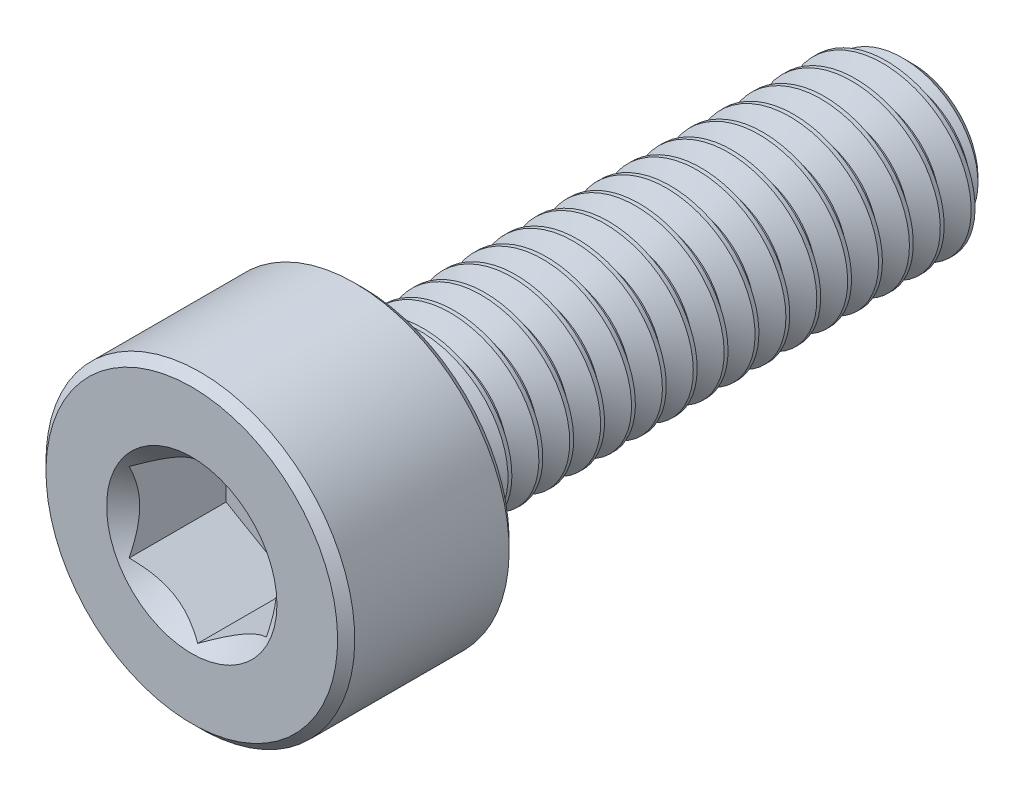
from build123d import *

# Parameters (mm, degrees)
CUT_EXTRUDE1_DEPTH     = 1.5
SPLIT1_SURFACE_1_BACK  = 13.278
SPLIT1_SURFACE_1_DEPTH = 26.556
SPLIT1_SURFACE_2_BACK  = 13.278
SPLIT1_SURFACE_2_DEPTH = 26.556
CUT_SWEEP1_PITCH       = 0.45


with BuildPart() as part:
    # Sketch2 → Revolve1 (revolve)
    with BuildSketch(Plane(origin=(0, 0, 0), x_dir=(0, 0, -1), z_dir=(1, 0, 0))):
        with BuildLine():
            Line((-5.25, 0), (-5.25, 2.125))
            Line((-5.25, 2.125), (-5.125, 2.25))
            Line((-5.125, 2.25), (-2.875, 2.25))
            Line((-2.875, 2.25), (-2.75, 2.125))
            Line((-2.75, 2.125), (-2.75, 1.375))
            ThreePointArc((-2.75, 1.375), (-2.713388348, 1.286611652), (-2.625, 1.25))
            Line((-2.625, 1.25), (4.957716426, 1.25))
            Line((4.957716426, 1.25), (5.25, 0.957716426))
            Line((5.25, 0.957716426), (5.25, 0))
            Line((5.25, 0), (-5.25, 0))
        make_face()
    revolve(axis=Axis((0, 0, -5.25), (0, 0, 1)))

    # Sketch3 → Cut-Extrude1 (cut)
    with BuildSketch(Plane.XY.offset(5.25)):
        Polygon((1, -0.577350269), (1, 0.577350269), (0, 1.154700538), (-1, 0.577350269), (-1, -0.577350269), (0, -1.154700538), align=None)
    extrude(amount=-CUT_EXTRUDE1_DEPTH, mode=Mode.SUBTRACT)

    # Cut-Extrude2 cone 1 section (through the dimple's axis) → Cut-Extrude2 (revolve, cut)
    with BuildSketch(Plane(origin=(0, 0, 5.25), x_dir=(0, -1, 0), z_dir=(1, 0, 0))):
        Polygon((0, 0), (1.241303079, 0), (0, 1.241303079), align=None)
    revolve(axis=Axis((0, 0, 5.25), (0, 0, -1)), mode=Mode.SUBTRACT)


with BuildPart() as body_2:
    # Split1: the piece behind the surface
    add(part.part)
    # Split1 surface: a surface, the sketch's curves swept straight by 26.556 mm
    with BuildLine(Plane(origin=(0, 0, 0), x_dir=(0, 0, -1), z_dir=(1, 0, 0)).offset(-SPLIT1_SURFACE_1_BACK), mode=Mode.PRIVATE) as split1_surface_1_path:
        Line((-2.625, -2.25), (-2.625, 2.25))
    split1_surface_1 = Shell.extrude(split1_surface_1_path.wire(), (1 * SPLIT1_SURFACE_1_DEPTH, 0 * SPLIT1_SURFACE_1_DEPTH, 0 * SPLIT1_SURFACE_1_DEPTH))
    split(bisect_by=split1_surface_1, keep=Keep.BOTTOM)

    # Cut-Sweep1: the profile of Sketch7 screwed along a right-hand helix of 18.777778 turns, 6 arcs to a turn; built about Z, then put on its axis
    cut_sweep1_z = Axis((0, 0, 0), (0, 0, 1))
    cut_sweep1_corners = [(1.274356964, 0, 0.0140625), (1.274356964, 0, -0.4078125), (0.957716426, 0, -0.225), (0.957716426, 0, -0.16875)]
    with BuildLine(mode=Mode.PRIVATE) as cut_sweep1_profile:
        Line(cut_sweep1_corners[0], cut_sweep1_corners[1])
        Line(cut_sweep1_corners[1], cut_sweep1_corners[2])
        Line(cut_sweep1_corners[2], cut_sweep1_corners[3])
        Line(cut_sweep1_corners[3], cut_sweep1_corners[0])
    cut_sweep1_cap = Face(cut_sweep1_profile.wire())
    cut_sweep1_turn_angles = [0, 30, 60, 90, 120, 150, 180, 210, 240, 270, 300, 330, 360]
    cut_sweep1_turn_weights = [1, 0.8660254037844387, 1, 0.8660254037844387, 1, 0.8660254037844387, 1, 0.8660254037844387, 1, 0.8660254037844387, 1, 0.8660254037844387, 1]
    cut_sweep1_turn_rails = [Edge.make_bspline([Vector(p[0], p[1], 0).rotate(cut_sweep1_z, cut_sweep1_turn_angles[k]) / cut_sweep1_turn_weights[k] + Vector(0, 0, p[2] + CUT_SWEEP1_PITCH * cut_sweep1_turn_angles[k] / 360) for k in range(13)], [0, 0, 0, 1, 1, 2, 2, 3, 3, 4, 4, 5, 5, 6, 6, 6], 2, cut_sweep1_turn_weights) for p in cut_sweep1_corners]
    cut_sweep1_turn_sides = [Face.make_surface_from_curves(cut_sweep1_turn_rails[p[0]], cut_sweep1_turn_rails[p[1]]) for p in [(0, 1), (1, 2), (2, 3), (3, 0)]]
    cut_sweep1_last_angles = [6480, 6510, 6540, 6570, 6600, 6630, 6660, 6690, 6720, 6740, 6760]
    cut_sweep1_last_weights = [1, 0.8660254037844387, 1, 0.8660254037844387, 1, 0.8660254037844387, 1, 0.8660254037844387, 1, 0.939692620785683, 1]
    cut_sweep1_last_rails = [Edge.make_bspline([Vector(p[0], p[1], 0).rotate(cut_sweep1_z, cut_sweep1_last_angles[k]) / cut_sweep1_last_weights[k] + Vector(0, 0, p[2] + CUT_SWEEP1_PITCH * cut_sweep1_last_angles[k] / 360) for k in range(11)], [0, 0, 0, 1, 1, 2, 2, 3, 3, 4, 4, 5, 5, 5], 2, cut_sweep1_last_weights) for p in cut_sweep1_corners]
    cut_sweep1_last_sides = [Face.make_surface_from_curves(cut_sweep1_last_rails[p[0]], cut_sweep1_last_rails[p[1]]) for p in [(0, 1), (1, 2), (2, 3), (3, 0)]]
    cut_sweep1 = Plane(origin=(0, 0, -5.25), x_dir=(0, 1, 0), z_dir=(0, 0, 1)) * Solid(Shell([*[p.moved(Location((0, 0, CUT_SWEEP1_PITCH * i))) for i in range(18) for p in cut_sweep1_turn_sides], *cut_sweep1_last_sides, cut_sweep1_cap, cut_sweep1_cap.rotate(cut_sweep1_z, 6760).moved(Location((0, 0, CUT_SWEEP1_PITCH * 6760 / 360)))]))
    add(cut_sweep1, mode=Mode.SUBTRACT)


with BuildPart() as part_1:
    add(part.part)

    # Split1: split by a surface, the side it looks to stays
    # Split1 surface: a surface, the sketch's curves swept straight by 26.556 mm
    with BuildLine(Plane(origin=(0, 0, 0), x_dir=(0, 0, -1), z_dir=(1, 0, 0)).offset(-SPLIT1_SURFACE_2_BACK), mode=Mode.PRIVATE) as split1_surface_2_path:
        Line((-2.625, -2.25), (-2.625, 2.25))
    split1_surface_2 = Shell.extrude(split1_surface_2_path.wire(), (1 * SPLIT1_SURFACE_2_DEPTH, 0 * SPLIT1_SURFACE_2_DEPTH, 0 * SPLIT1_SURFACE_2_DEPTH))
    split(bisect_by=split1_surface_2, keep=Keep.TOP)

    add(body_2.part)  # Revolve2 merges body 2
    # Sketch8 → Revolve2 (revolve)
    with BuildSketch(Plane(origin=(0, 0, 0), x_dir=(0, 0, -1), z_dir=(1, 0, 0)), mode=Mode.PRIVATE) as revolve2_sk:
        Polygon((-2.75, 0), (-2.75, 1.25), (-2.625, 1.25), (-1.903312164, 0), align=None)
    revolve(revolve2_sk.sketch.rotate(Axis((0, 0, 1.903312164), (0, 0, 1)), 270), axis=Axis((0, 0, 1.903312164), (0, 0, 1)))


solid = part_1.part
